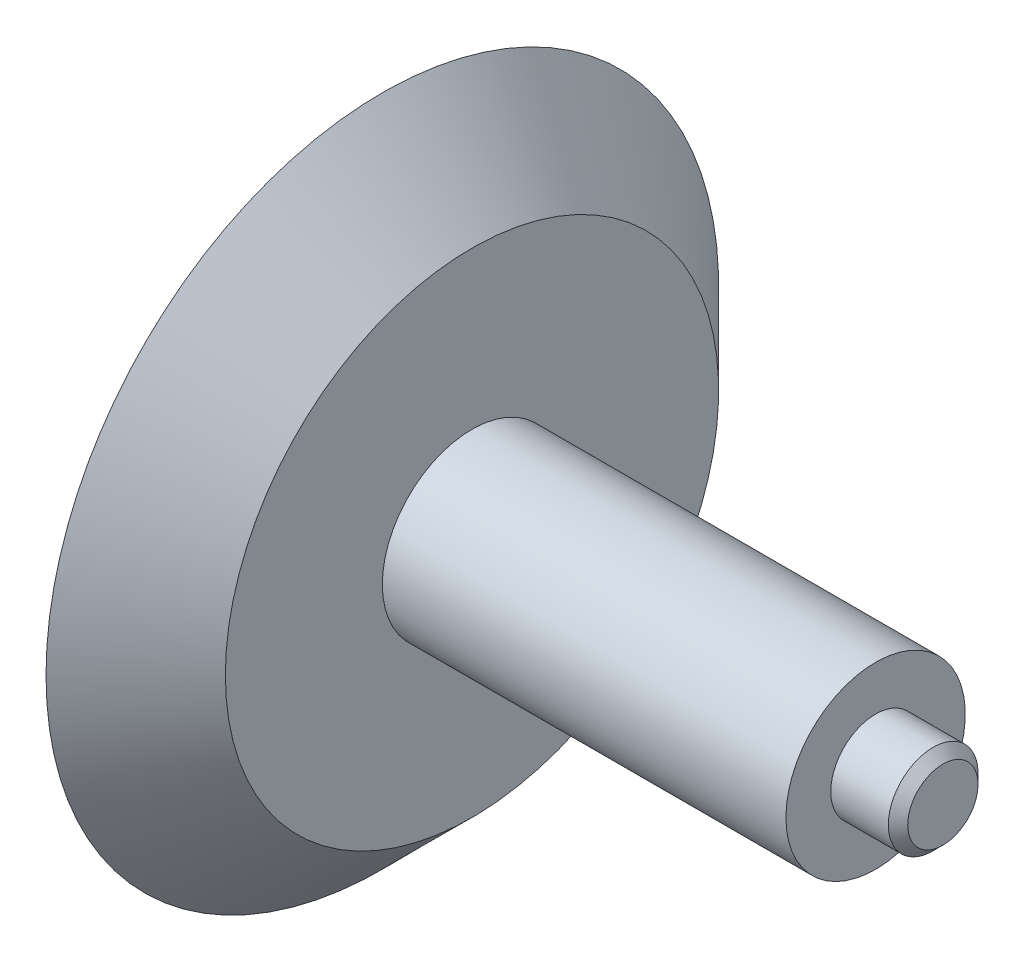
from build123d import *


# Read off the part's stored shape, not the designer's step: M2 机械螺纹 螺柱1
with BuildPart() as part:
    # 草图1 → 旋转1 (revolve)
    with BuildSketch(Plane.XY, mode=Mode.PRIVATE) as revolve_1_sk:
        Polygon((0, 0), (0, 7.5), (2, 5.5), (2, 2), (11, 2), (11, 1), (12.5, 1), (12.5, 0), align=None)
    revolve(revolve_1_sk.sketch.rotate(Axis((0, 0, 0), (1, 0, 0)), 90), axis=Axis((0, 0, 0), (1, 0, 0)))

    # M2 机械螺纹 螺柱1 outline → M2 机械螺纹 螺柱1 (revolve, cut)
    with BuildSketch(Plane.YX):
        Polygon((1, 12.5), (0.7835, 12.5), (1, 12.2835), align=None)
    revolve(axis=Axis((0, 0, 0), (1, 0, 0)), mode=Mode.SUBTRACT)


solid = part.part
